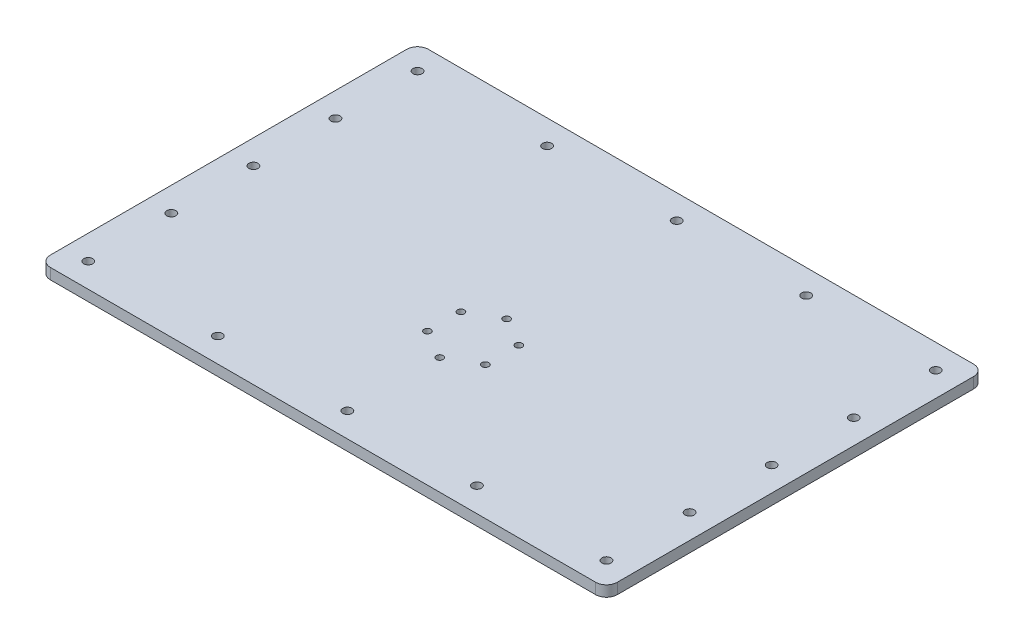
from build123d import *

# Parameters (mm, degrees)
SKETCH1_R          = 4.2
SKETCH1_R_2        = 3.2
BASE_FLANGE1_DEPTH = 10


# Sheet-metal steps are written as plain solids
with BuildPart() as part:
    # Sketch1 → Base-Flange1 (new body)
    with BuildSketch(Plane(origin=(0, 0, 0), x_dir=(1, 0, 0), z_dir=(0, 1, 0))):
        with BuildLine():
            Line((-252.5, 175), (252.5, 175))
            ThreePointArc((252.5, 175), (259.571067812, 172.071067812), (262.5, 165))
            Line((262.5, 165), (262.5, -165))
            ThreePointArc((262.5, -165), (259.571067812, -172.071067812), (252.5, -175))
            Line((252.5, -175), (-252.5, -175))
            ThreePointArc((-252.5, -175), (-259.571067812, -172.071067812), (-262.5, -165))
            Line((-262.5, -165), (-262.5, 165))
            ThreePointArc((-262.5, 165), (-259.571067812, 172.071067812), (-252.5, 175))
        make_face()
        with Locations(Location((-240, 152.5, 0), (0, 0, 270))):
            Circle(SKETCH1_R, mode=Mode.SUBTRACT)
        with Locations(Location((-240, 76.5, 0), (0, 0, 270))):
            Circle(SKETCH1_R, mode=Mode.SUBTRACT)
        with Locations(Location((-240, 0.5, 0), (0, 0, 270))):
            Circle(SKETCH1_R, mode=Mode.SUBTRACT)
        with Locations(Location((-240, -75.5, 0), (0, 0, 270))):
            Circle(SKETCH1_R, mode=Mode.SUBTRACT)
        with Locations(Location((240, 152.5, 0), (0, 0, 270))):
            Circle(SKETCH1_R, mode=Mode.SUBTRACT)
        with Locations(Location((240, 76.5, 0), (0, 0, 270))):
            Circle(SKETCH1_R, mode=Mode.SUBTRACT)
        with Locations(Location((240, 0.5, 0), (0, 0, 270))):
            Circle(SKETCH1_R, mode=Mode.SUBTRACT)
        with Locations(Location((240, -75.5, 0), (0, 0, 270))):
            Circle(SKETCH1_R, mode=Mode.SUBTRACT)
        with Locations(Location((0, -5, 0), (0, 0, 270))):
            Circle(SKETCH1_R_2, mode=Mode.SUBTRACT)
        with Locations(Location((-120, 152.5, 0), (0, 0, 270))):
            Circle(SKETCH1_R, mode=Mode.SUBTRACT)
        with Locations(Location((0, 152.5, 0), (0, 0, 270))):
            Circle(SKETCH1_R, mode=Mode.SUBTRACT)
        with Locations(Location((120, 152.5, 0), (0, 0, 270))):
            Circle(SKETCH1_R, mode=Mode.SUBTRACT)
        with Locations(Location((26.846787517, -20.5, 0), (0, 0, 270))):
            Circle(SKETCH1_R_2, mode=Mode.SUBTRACT)
        with Locations(Location((26.846787517, -51.5, 0), (0, 0, 270))):
            Circle(SKETCH1_R_2, mode=Mode.SUBTRACT)
        with Locations(Location((0, -67, 0), (0, 0, 270))):
            Circle(SKETCH1_R_2, mode=Mode.SUBTRACT)
        with Locations(Location((-26.846787517, -51.5, 0), (0, 0, 270))):
            Circle(SKETCH1_R_2, mode=Mode.SUBTRACT)
        with Locations(Location((-26.846787517, -20.5, 0), (0, 0, 270))):
            Circle(SKETCH1_R_2, mode=Mode.SUBTRACT)
        with Locations(Location((-240, -152.5, 0), (0, 0, 270))):
            Circle(SKETCH1_R, mode=Mode.SUBTRACT)
        with Locations(Location((-120, -152.5, 0), (0, 0, 270))):
            Circle(SKETCH1_R, mode=Mode.SUBTRACT)
        with Locations(Location((0, -152.5, 0), (0, 0, 270))):
            Circle(SKETCH1_R, mode=Mode.SUBTRACT)
        with Locations(Location((120, -152.5, 0), (0, 0, 270))):
            Circle(SKETCH1_R, mode=Mode.SUBTRACT)
        with Locations(Location((240, -152.5, 0), (0, 0, 270))):
            Circle(SKETCH1_R, mode=Mode.SUBTRACT)
    extrude(amount=BASE_FLANGE1_DEPTH)


solid = part.part
